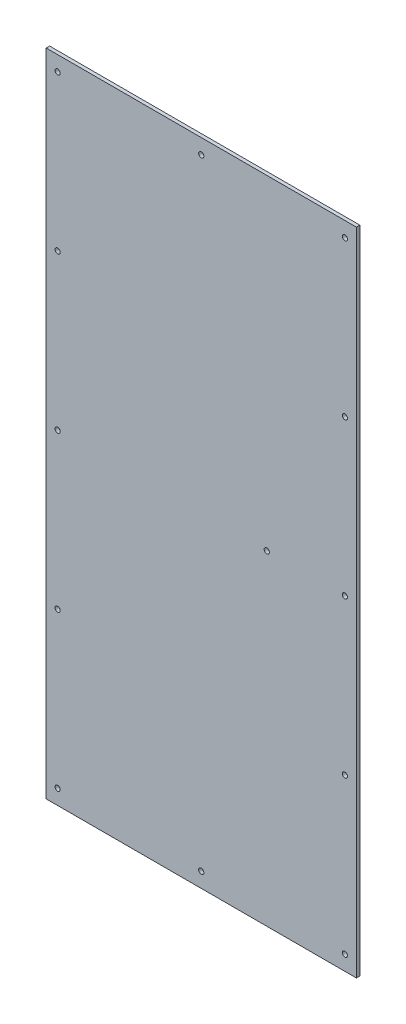
from build123d import *

# Parameters (mm, degrees)
SKETCH_1_W         = 270
SKETCH_1_H         = 566
SKETCH_1_R         = 2.25
EXTRUDE_1_DEPTH    = 3
SKETCH1_R          = 2.25
CUT_EXTRUDE1_DEPTH = 628.108443573


with BuildPart() as part:
    # Эскиз1 → Бобышка-Вытянуть1 (new body)
    with BuildSketch(Plane.XY):
        with Locations((135, 283)):
            Rectangle(SKETCH_1_W, SKETCH_1_H)
        with Locations((10, 553)):
            Circle(SKETCH_1_R, mode=Mode.SUBTRACT)
        with Locations((10, 418)):
            Circle(SKETCH_1_R, mode=Mode.SUBTRACT)
        with Locations((10, 283)):
            Circle(SKETCH_1_R, mode=Mode.SUBTRACT)
        with Locations((10, 148)):
            Circle(SKETCH_1_R, mode=Mode.SUBTRACT)
        with Locations((10, 13)):
            Circle(SKETCH_1_R, mode=Mode.SUBTRACT)
        with Locations((135, 553)):
            Circle(SKETCH_1_R, mode=Mode.SUBTRACT)
        with Locations((135, 13)):
            Circle(SKETCH_1_R, mode=Mode.SUBTRACT)
        with Locations((260, 553)):
            Circle(SKETCH_1_R, mode=Mode.SUBTRACT)
        with Locations((260, 418)):
            Circle(SKETCH_1_R, mode=Mode.SUBTRACT)
        with Locations((260, 283)):
            Circle(SKETCH_1_R, mode=Mode.SUBTRACT)
        with Locations((260, 148)):
            Circle(SKETCH_1_R, mode=Mode.SUBTRACT)
        with Locations((260, 13)):
            Circle(SKETCH_1_R, mode=Mode.SUBTRACT)
    extrude(amount=EXTRUDE_1_DEPTH)

    # Sketch1 → Cut-Extrude1 (cut, through all)
    with BuildSketch(Plane.XY.offset(3)):
        with Locations((192, 283)):
            Circle(SKETCH1_R)
    extrude(amount=-CUT_EXTRUDE1_DEPTH, mode=Mode.SUBTRACT)


solid = part.part
